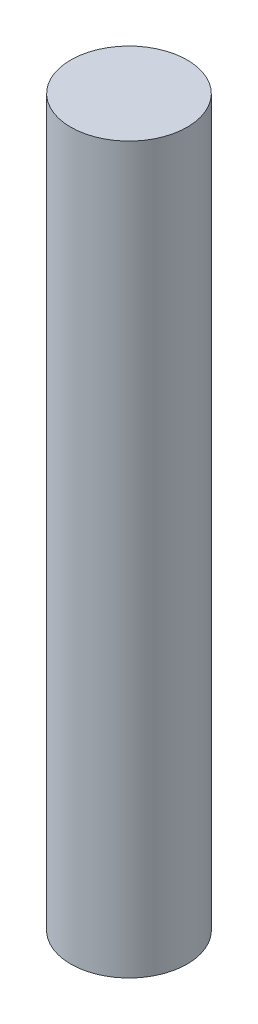
from build123d import *

# Parameters (mm, degrees)
SKETCH1_R           = 3.95
BOSS_EXTRUDE1_DEPTH = 49.15


with BuildPart() as part:
    # Sketch1 → Boss-Extrude1 (new body)
    with BuildSketch(Plane(origin=(0, 0, 0), x_dir=(1, 0, 0), z_dir=(0, 1, 0))):
        Circle(SKETCH1_R)
    extrude(amount=BOSS_EXTRUDE1_DEPTH)


solid = part.part
